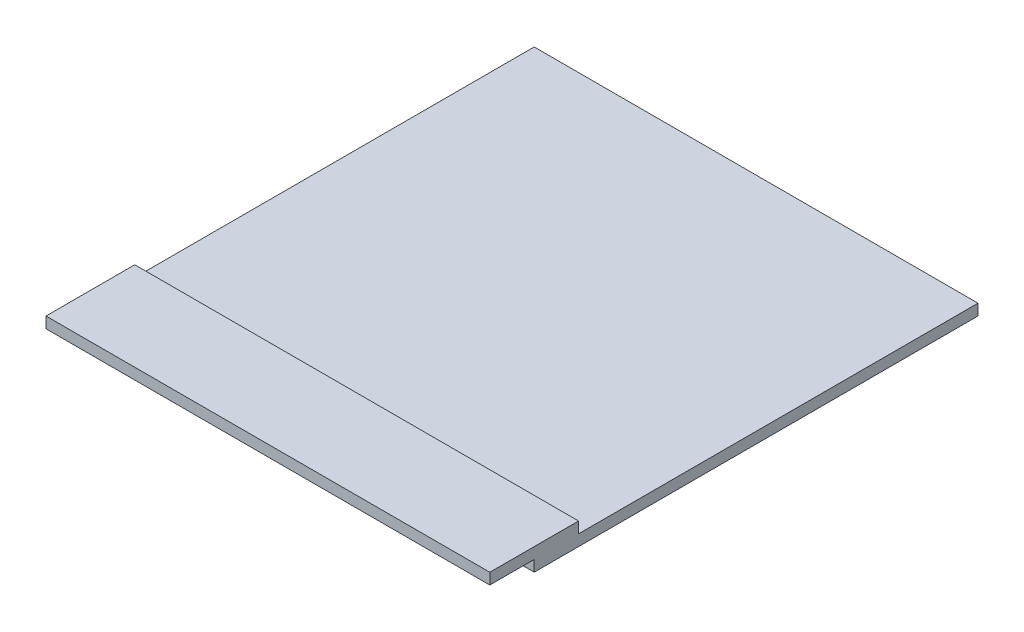
from build123d import *

# Parameters (mm, degrees)
SKETCH1_W           = 200
SKETCH1_H           = 200
BOSS_EXTRUDE1_DEPTH = 5
SKETCH2_W           = 200
SKETCH2_H           = 40
BOSS_EXTRUDE2_DEPTH = 5


with BuildPart() as part:
    # Sketch1 → Boss-Extrude1 (new body)
    with BuildSketch(Plane(origin=(0, 0, 0), x_dir=(1, 0, 0), z_dir=(0, 1, 0))):
        with Locations((100, 100)):
            Rectangle(SKETCH1_W, SKETCH1_H)
    extrude(amount=BOSS_EXTRUDE1_DEPTH)

    # Sketch2 → Boss-Extrude2 (add)
    with BuildSketch(Plane(origin=(0, 5, 0), x_dir=(1, 0, 0), z_dir=(0, 1, 0))):
        with Locations((100, 0)):
            Rectangle(SKETCH2_W, SKETCH2_H)
    extrude(amount=BOSS_EXTRUDE2_DEPTH)


solid = part.part
